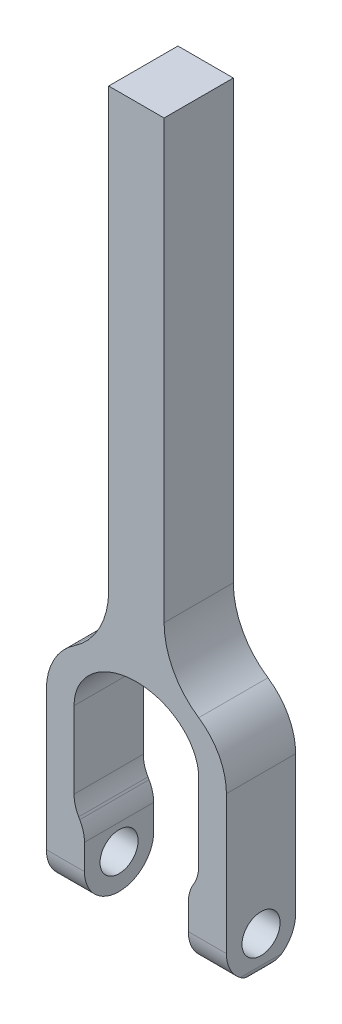
from build123d import *

# Parameters (mm, degrees)
BOSS_EXTRUDE1_DEPTH      = 10
BOSS_EXTRUDE1_DEPTH_BACK = 10
FILLET1_START            = -10
FILLET1_DEPTH            = 20
FILLET1_2_DEPTH          = 20
FILLET1_START_2          = -27
FILLET1_3_DEPTH          = 54
CUT_EXTRUDE1_DEPTH       = 202.930681292
CUT_EXTRUDE1_DEPTH_BACK  = 202.930681292
SKETCH2_R                = 5.5


with BuildPart() as part:
    # Sketch1 → Boss-Extrude1 (new, two sides: drawn at the far end of the back side and taken through both)
    with BuildSketch(Plane.XY.offset(-BOSS_EXTRUDE1_DEPTH_BACK)):
        with BuildLine():
            Line((15, -10), (15, 10))
            Line((15, 10), (18, 15.196152423))
            Line((18, 15.196152423), (18, 40))
            add(Edge.make_bspline(
                [(18, 40), (18, 55), (0, 55), (-18, 55), (-18, 40)],
                knots=[3.141592654, 3.141592654, 3.141592654, 4.71238898, 4.71238898, 6.283185307, 6.283185307, 6.283185307], degree=2, weights=[1, 0.707106781, 1, 0.707106781, 1]))
            Line((-18, 40), (-18, 15.196152423))
            Line((-18, 15.196152423), (-15, 10))
            Line((-15, 10), (-15, -10))
            Line((-15, -10), (-24, -10))
            ThreePointArc((-24, -10), (-25.414213562, -9.414213562), (-26, -8))
            Line((-26, -8), (-26, 40))
            ThreePointArc((-26, 40), (-23.875, 48.5), (-18, 55))
            ThreePointArc((-18, 55), (-10.65625, 63.125), (-8, 73.75))
            Line((-8, 73.75), (-8, 200))
            Line((-8, 200), (8, 200))
            Line((8, 200), (8, 73.75))
            ThreePointArc((8, 73.75), (10.65625, 63.125), (18, 55))
            ThreePointArc((18, 55), (23.875, 48.5), (26, 40))
            Line((26, 40), (26, -8))
            ThreePointArc((26, -8), (25.414213562, -9.414213562), (24, -10))
            Line((24, -10), (15, -10))
        make_face()
    extrude(amount=BOSS_EXTRUDE1_DEPTH + BOSS_EXTRUDE1_DEPTH_BACK)

    # Fillet1: read off the stored shape, not the designer's step
    # Fillet1 outline → Fillet1 (add)
    with BuildSketch(Plane.XY.offset(FILLET1_START)):
        with BuildLine():
            Line((18, 15.196152423), (18, 17.875644347))
            ThreePointArc((18, 17.875644347), (17.659258263, 15.287453896), (16.660254038, 12.875644347))
            Line((16.660254038, 12.875644347), (18, 15.196152423))
        make_face()
        with BuildLine():
            Line((-18, 15.196152423), (-16.660254038, 12.875644347))
            ThreePointArc((-16.660254038, 12.875644347), (-17.659258263, 15.287453896), (-18, 17.875644347))
            Line((-18, 17.875644347), (-18, 15.196152423))
        make_face()
    extrude(amount=FILLET1_DEPTH)

    # Fillet1 2 outline → Fillet1 2 (cut)
    with BuildSketch(Plane.XY.offset(FILLET1_START)):
        with BuildLine():
            ThreePointArc((15, 7.320508076), (15.340741737, 9.908698527), (16.339745962, 12.320508076))
            Line((16.339745962, 12.320508076), (15, 10))
            Line((15, 10), (15, 7.320508076))
        make_face()
        with BuildLine():
            ThreePointArc((-16.339745962, 12.320508076), (-15.340741737, 9.908698527), (-15, 7.320508076))
            Line((-15, 7.320508076), (-15, 10))
            Line((-15, 10), (-16.339745962, 12.320508076))
        make_face()
    extrude(amount=FILLET1_2_DEPTH, mode=Mode.SUBTRACT)

    # Fillet1 3 outline → Fillet1 3 (cut)
    with BuildSketch(Plane.YZ.offset(FILLET1_START_2)):
        with BuildLine():
            Line((-10, 10), (-10, 0))
            ThreePointArc((-10, 0), (-7.071067812, 7.071067812), (0, 10))
            Line((0, 10), (-10, 10))
        make_face()
        with BuildLine():
            ThreePointArc((0, -10), (-7.071067812, -7.071067812), (-10, 0))
            Line((-10, 0), (-10, -10))
            Line((-10, -10), (0, -10))
        make_face()
    extrude(amount=FILLET1_3_DEPTH, mode=Mode.SUBTRACT)

    # Sketch2 → Cut-Extrude1 (cut, two sides: drawn at the far end of the back side and taken through both)
    with BuildSketch(Plane(origin=(0, 0, 0), x_dir=(0, 0, -1), z_dir=(1, 0, 0)).offset(-CUT_EXTRUDE1_DEPTH_BACK)):
        Circle(SKETCH2_R)
    extrude(amount=CUT_EXTRUDE1_DEPTH + CUT_EXTRUDE1_DEPTH_BACK, mode=Mode.SUBTRACT)


solid = part.part
